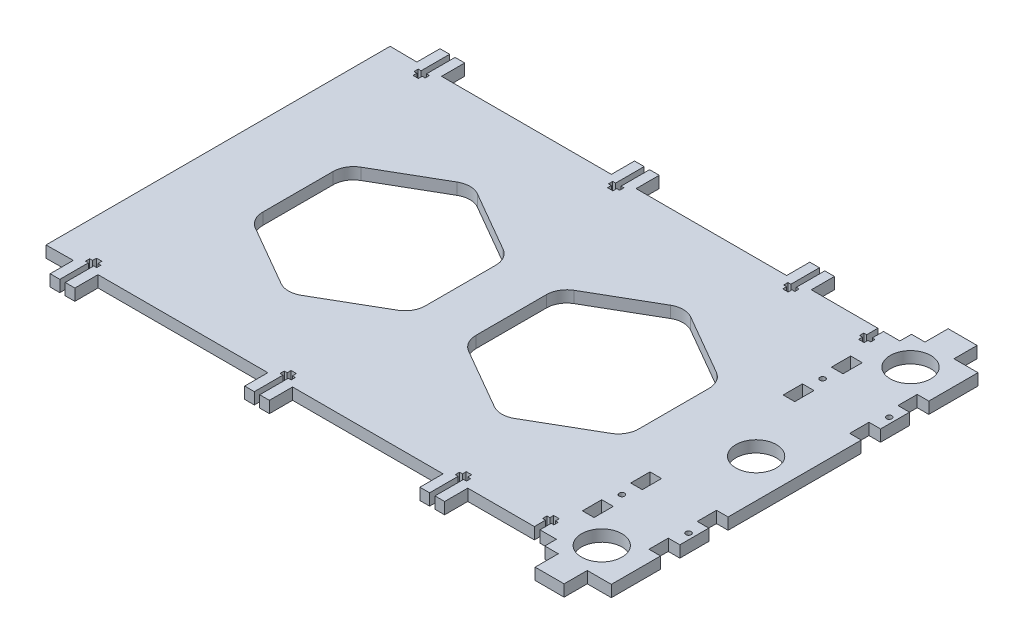
from build123d import *

# Parameters (mm, degrees)
SKETCH_1_R      = 10.5
SKETCH_1_R_2    = 1.4
SKETCH_1_W      = 6
SKETCH_1_H      = 10
EXTRUDE_1_DEPTH = 6


with BuildPart() as part:
    # Эскиз1 → Бобышка-Вытянуть1 (new body)
    with BuildSketch(Plane(origin=(0, 0, 0), x_dir=(1, 0, 0), z_dir=(0, 1, 0))):
        Polygon((-117.473635401, -101.4099491), (-117.473635401, -89.4099491), (-29.473635401, -89.409373018), (-29.473635401, -101.409373018), (-24.473635401, -101.409373018), (-24.473635401, -86.609373018), (-25.973635401, -86.609373018), (-25.973635401, -84.409373018), (-24.473635401, -84.409373018), (-24.473635401, -82.409373018), (-21.673635401, -82.409373018), (-21.673635401, -84.409373018), (-20.173635401, -84.409373018), (-20.173635401, -86.609373018), (-21.673635401, -86.609373018), (-21.673635401, -101.409373018), (-16.673635401, -101.409373018), (-16.673635401, -89.4099491), (61.326364599, -89.4099491), (61.326364599, -101.4099491), (66.326364599, -101.4099491), (66.326364599, -86.6099491), (64.826364599, -86.6099491), (64.826364599, -84.4099491), (66.326364599, -84.4099491), (66.326364599, -82.4099491), (69.126364599, -82.4099491), (69.126364599, -84.4099491), (70.626364599, -84.4099491), (70.626364599, -86.6099491), (69.126364599, -86.6099491), (69.126364599, -101.4099491), (74.126364599, -101.4099491), (74.126364599, -89.4099491), (108.626364599, -89.4099491), (108.626364599, -83.6099491), (107.126364599, -83.6099491), (107.126364599, -81.4099491), (108.626364599, -81.4099491), (108.626364599, -79.4099491), (111.535743516, -79.4099491), (111.535743516, -81.4099491), (112.926364599, -81.4099491), (112.926364599, -83.6099491), (111.535743516, -83.6099491), (111.535743516, -89.4099491), (120.035743516, -89.4099491), (120.035743516, -95.4099491), (127.035743516, -95.4099491), (127.035743516, -107.4099491), (142.035743516, -107.4099491), (142.035743516, -95.4099491), (154.504146002, -95.4099491), (154.504146002, -69.9099491), (148.504146002, -69.9099491), (148.504146002, -59.9099491), (154.504146002, -59.9099491), (154.504146002, -44.9099491), (148.504146002, -44.9099491), (148.504146002, -34.9099491), (154.504146002, -34.9099491), (154.504146002, 34.0900509), (148.504146002, 34.0900509), (148.504146002, 44.0900509), (154.504146002, 44.0900509), (154.504146002, 59.0900509), (148.504146002, 59.0900509), (148.504146002, 69.0900509), (154.504146002, 69.0900509), (154.504146002, 94.5900509), (142.035743516, 94.5900509), (142.035743516, 106.5900509), (127.035743516, 106.5900509), (127.035743516, 94.5900509), (120.035743516, 94.5900509), (120.035743516, 88.5900509), (111.535743516, 88.5900509), (111.535743516, 82.7900509), (112.926364599, 82.7900509), (112.926364599, 80.5900509), (111.535743516, 80.5900509), (111.535743516, 78.5900509), (108.626364599, 78.5900509), (108.626364599, 80.5900509), (107.126364599, 80.5900509), (107.126364599, 82.7900509), (108.626364599, 82.7900509), (108.626364599, 88.5900509), (74.126364599, 88.5900509), (74.126364599, 100.5900509), (69.126364599, 100.5900509), (69.126364599, 85.7900509), (70.626364599, 85.7900509), (70.626364599, 83.5900509), (69.126364599, 83.5900509), (69.126364599, 81.5900509), (66.326364599, 81.5900509), (66.326364599, 83.5900509), (64.826364599, 83.5900509), (64.826364599, 85.7900509), (66.326364599, 85.7900509), (66.326364599, 100.5900509), (61.326364599, 100.5900509), (61.326364599, 88.5900509), (-16.673635401, 88.5900509), (-16.673635401, 100.589474817), (-21.673635401, 100.589474817), (-21.673635401, 85.789474817), (-20.173635401, 85.789474817), (-20.173635401, 83.589474817), (-21.673635401, 83.589474817), (-21.673635401, 81.589474817), (-24.473635401, 81.589474817), (-24.473635401, 83.589474817), (-25.973635401, 83.589474817), (-25.973635401, 85.789474817), (-24.473635401, 85.789474817), (-24.473635401, 100.589474817), (-29.473635401, 100.589474817), (-29.473635401, 88.589474817), (-117.473635401, 88.5900509), (-117.473635401, 100.5900509), (-122.473635401, 100.5900509), (-122.473635401, 85.7900509), (-120.973635401, 85.7900509), (-120.973635401, 83.5900509), (-122.473635401, 83.5900509), (-122.473635401, 81.5900509), (-125.273635401, 81.5900509), (-125.273635401, 83.5900509), (-126.773635401, 83.5900509), (-126.773635401, 85.7900509), (-125.273635401, 85.7900509), (-125.273635401, 100.5900509), (-130.273635401, 100.5900509), (-130.273635401, 88.5900509), (-144.273635401, 88.746984561), (-144.273635401, -89.566882761), (-130.273635401, -89.4099491), (-130.273635401, -101.4099491), (-125.273635401, -101.4099491), (-125.273635401, -86.6099491), (-126.773635401, -86.6099491), (-126.773635401, -84.4099491), (-125.273635401, -84.4099491), (-125.273635401, -82.4099491), (-122.473635401, -82.4099491), (-122.473635401, -84.4099491), (-120.973635401, -84.4099491), (-120.973635401, -86.6099491), (-122.473635401, -86.6099491), (-122.473635401, -101.4099491), align=None)
        with Locations((134.535743516, 79.5900509)):
            Circle(SKETCH_1_R, mode=Mode.SUBTRACT)
        with Locations((134.535743516, -0.4099491)):
            Circle(SKETCH_1_R, mode=Mode.SUBTRACT)
        with Locations((151.504146002, 51.5900509)):
            Circle(SKETCH_1_R_2, mode=Mode.SUBTRACT)
        with Locations((116.978141574, 51.5900509)):
            Circle(SKETCH_1_R_2, mode=Mode.SUBTRACT)
        with Locations((116.978141574, -52.4099491)):
            Circle(SKETCH_1_R_2, mode=Mode.SUBTRACT)
        with Locations((151.504146002, -52.4099491)):
            Circle(SKETCH_1_R_2, mode=Mode.SUBTRACT)
        with Locations((134.535743516, -80.4099491)):
            Circle(SKETCH_1_R, mode=Mode.SUBTRACT)
        with BuildLine():
            Line((-23.916948741, 26.938229251), (-55.495903408, 45.170347229))
            ThreePointArc((-55.495903408, 45.170347229), (-60.759062907, 46.580606949), (-66.022222533, 45.170347705))
            Line((-66.022222533, 45.170347705), (-97.601176456, 26.938228368))
            ThreePointArc((-97.601176456, 26.938228368), (-101.454076716, 23.085328612), (-102.864336112, 17.822169354))
            Line((-102.864336112, 17.822169354), (-102.864336739, -0.4099491))
            Line((-102.864336739, -0.4099491), (-102.864336112, -18.642067554))
            ThreePointArc((-102.864336112, -18.642067554), (-101.454076716, -23.905226813), (-97.601176456, -27.758126569))
            Line((-97.601176456, -27.758126569), (-66.022222533, -45.990245906))
            ThreePointArc((-66.022222533, -45.990245906), (-60.759062907, -47.40050515), (-55.495903408, -45.99024543))
            Line((-55.495903408, -45.99024543), (-23.916948741, -27.758127452))
            ThreePointArc((-23.916948741, -27.758127452), (-20.064048696, -23.905227053), (-18.653789757, -18.642067359))
            Line((-18.653789757, -18.642067359), (-18.653789757, 17.822169158))
            ThreePointArc((-18.653789757, 17.822169158), (-20.064048696, 23.085328852), (-23.916948741, 26.938229251))
        make_face(mode=Mode.SUBTRACT)
        with BuildLine():
            Line((91.872555356, -0.4099491), (91.872555984, 17.822170089))
            ThreePointArc((91.872555984, 17.822170089), (90.462296282, 23.08532917), (86.609396157, 26.938228929))
            Line((86.609396157, 26.938228929), (55.030441843, 45.170346703))
            ThreePointArc((55.030441843, 45.170346703), (49.767282136, 46.580606642), (44.504122247, 45.170347383))
            Line((44.504122247, 45.170347383), (12.925166834, 26.938228046))
            ThreePointArc((12.925166834, 26.938228046), (9.072267233, 23.08532824), (7.66200811, 17.822169354))
            Line((7.66200811, 17.822169354), (7.66200811, -18.642067554))
            ThreePointArc((7.66200811, -18.642067554), (9.072267233, -23.90522644), (12.925166834, -27.758126246))
            Line((12.925166834, -27.758126246), (44.504122247, -45.990245583))
            ThreePointArc((44.504122247, -45.990245583), (49.767282136, -47.400504843), (55.030441843, -45.990244903))
            Line((55.030441843, -45.990244903), (86.609396157, -27.758127129))
            ThreePointArc((86.609396157, -27.758127129), (90.462296282, -23.90522737), (91.872555984, -18.64206829))
            Line((91.872555984, -18.64206829), (91.872555356, -0.4099491))
        make_face(mode=Mode.SUBTRACT)
        with Locations((117.035743516, 64.0900509)):
            Rectangle(SKETCH_1_W, SKETCH_1_H, mode=Mode.SUBTRACT)
        with Locations((117.035743516, 39.0900509)):
            Rectangle(SKETCH_1_W, SKETCH_1_H, mode=Mode.SUBTRACT)
        with Locations((117.035743516, -39.9099491)):
            Rectangle(SKETCH_1_W, SKETCH_1_H, mode=Mode.SUBTRACT)
        with Locations((117.035743516, -64.9099491)):
            Rectangle(SKETCH_1_W, SKETCH_1_H, mode=Mode.SUBTRACT)
    extrude(amount=EXTRUDE_1_DEPTH)


solid = part.part
